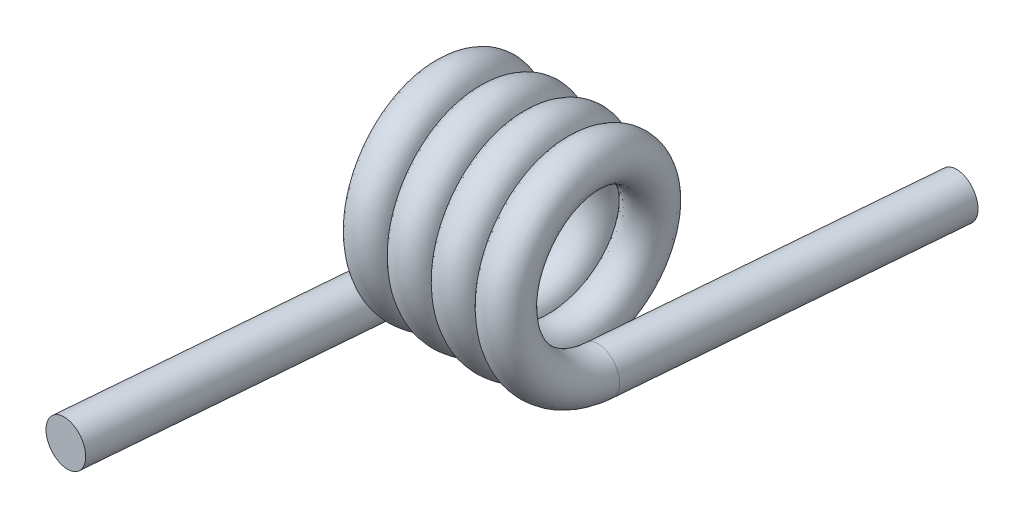
from build123d import *

# Parameters (mm, degrees)
SWEEP1_PITCH   = 1.01
SKETCH3_R      = 0.5
EXTRUDE1_DEPTH = 7.62
SKETCH4_R      = 0.5
EXTRUDE2_DEPTH = 7.62


with BuildPart() as part:
    # Sweep1: arcs per turn and ends read off the stored shape
    # Sweep1: the profile of Sketch2 screwed along a right-hand helix through 4 turns, 6 arcs to a turn; built about Z, then put on its axis
    sweep1_z = Axis((0, 0, 0), (0, 0, 1))
    sweep1_corners = [(1.855366594, -0.041982846, 0.496231095), (2.398003875, -0.003762697, 0.044474522), (1.944633406, 0.041982846, -0.496231095), (1.401996125, 0.003762697, -0.044474522)]
    with BuildLine(mode=Mode.PRIVATE) as sweep1_profile:
        ThreePointArc((1.855366594, -0.041982846, 0.496231095), (2.220581332, -0.032346984, 0.382336608), (2.398003875, -0.003762697, 0.044474522))
        ThreePointArc((2.398003875, -0.003762697, 0.044474522), (2.283702501, 0.027025727, -0.319440136), (1.944633406, 0.041982846, -0.496231095))
        ThreePointArc((1.944633406, 0.041982846, -0.496231095), (1.579418668, 0.032346984, -0.382336608), (1.401996125, 0.003762697, -0.044474522))
        ThreePointArc((1.401996125, 0.003762697, -0.044474522), (1.516297499, -0.027025727, 0.319440136), (1.855366594, -0.041982846, 0.496231095))
    sweep1_cap = Face(sweep1_profile.wire())
    sweep1_arcs = [((1.855366594, -0.041982846, 0.496231095), (2.353370468, -0.045745543, 0.540705617), (2.398003875, -0.003762697, 0.044474522), (1, 0.7071067811865476, 1)), ((2.398003875, -0.003762697, 0.044474522), (2.442637281, 0.03822015, -0.451756573), (1.944633406, 0.041982846, -0.496231095), (1, 0.7071067811865476, 1)), ((1.944633406, 0.041982846, -0.496231095), (1.446629532, 0.045745543, -0.540705617), (1.401996125, 0.003762697, -0.044474522), (1, 0.7071067811865476, 1)), ((1.401996125, 0.003762697, -0.044474522), (1.357362719, -0.03822015, 0.451756573), (1.855366594, -0.041982846, 0.496231095), (1, 0.7071067811865476, 1))]  # start, shoulder, end, weights
    sweep1_turn_angles = [0, 30, 60, 90, 120, 150, 180, 210, 240, 270, 300, 330, 360]
    sweep1_turn_weights = [1, 0.8660254037844387, 1, 0.8660254037844387, 1, 0.8660254037844387, 1, 0.8660254037844387, 1, 0.8660254037844387, 1, 0.8660254037844387, 1]
    sweep1_turn_sides = [Face.make_bezier_surface([[Vector(p[j][0], p[j][1], 0).rotate(sweep1_z, sweep1_turn_angles[2 * i + k]) / sweep1_turn_weights[2 * i + k] + Vector(0, 0, p[j][2] + SWEEP1_PITCH * sweep1_turn_angles[2 * i + k] / 360) for k in range(3)] for j in range(3)], [[p[3][j] * sweep1_turn_weights[2 * i + k] for k in range(3)] for j in range(3)]) for p in sweep1_arcs for i in range(6)]
    sweep1 = Plane(origin=(0, 0, 0), x_dir=(0, -1, 0), z_dir=(1, 0, 0)) * Solid(Shell([*[p.moved(Location((0, 0, SWEEP1_PITCH * i))) for i in range(4) for p in sweep1_turn_sides], sweep1_cap, sweep1_cap.rotate(sweep1_z, 1440).moved(Location((0, 0, SWEEP1_PITCH * 1440 / 360)))]))
    add(sweep1)

    # Sketch3 → Extrude1 (add)
    with BuildSketch(Plane(origin=(0, 0, 0), x_dir=(-0.9924621899947835, -0.08926681293390697, -0.0839656926332493), z_dir=(-0.08430224836687618, -9.439497794527796e-15, 0.9964402294770568))):
        with Locations(Location((0.169606945, 1.892414723, 0), (0, 0, 354.87857121))):
            Circle(SKETCH3_R)
    extrude(amount=EXTRUDE1_DEPTH)

    # Sketch4 → Extrude2 (add)
    with BuildSketch(Plane(origin=(0.028711751, 0, -0.339368693), x_dir=(0.9635637609199703, -0.25475329235134614, 0.08152078678418156), z_dir=(0.08430224836687623, 6.512151928816934e-14, -0.9964402294770568))):
        with Locations(Location((4.37682885, 0.81177198, 0), (0, 0, 165.241032939))):
            Circle(SKETCH4_R)
    extrude(amount=EXTRUDE2_DEPTH)


solid = part.part
